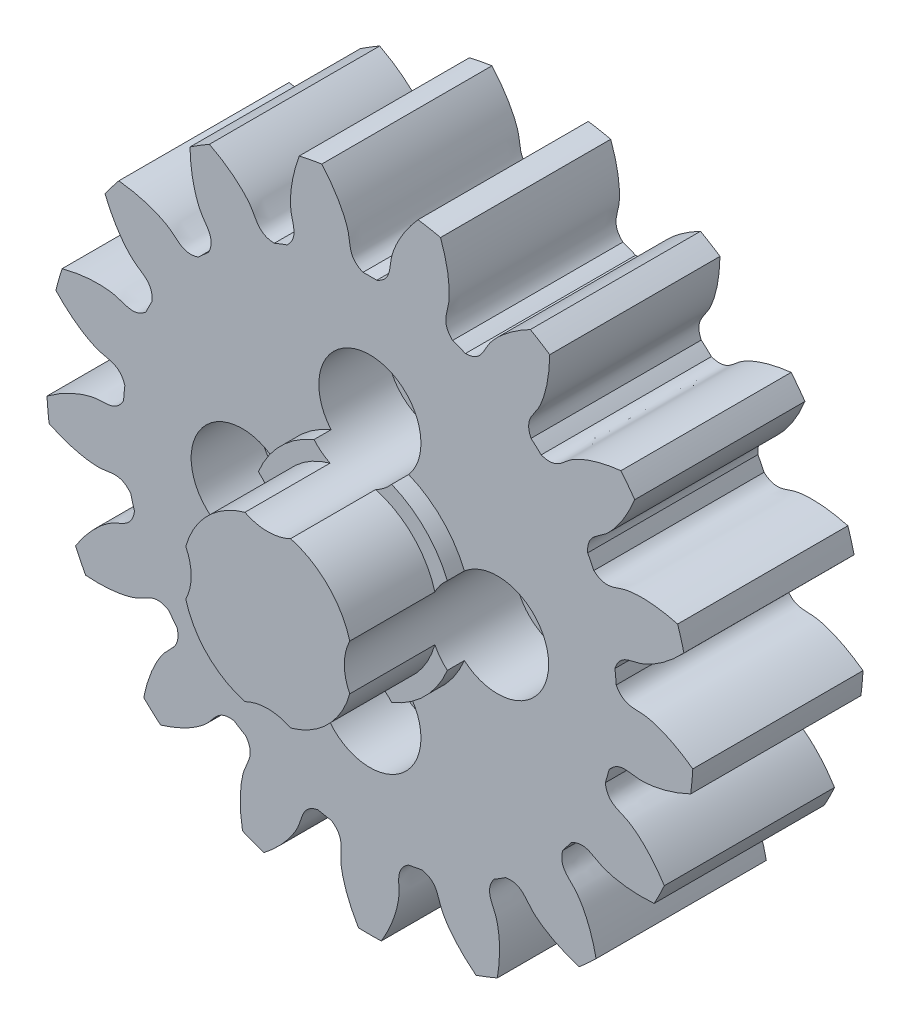
from build123d import *

# Parameters (mm, degrees)
SKETCH_1_R               = 19
EXTRUDE_1_DEPTH          = 10
CUT_EXTRUDE_1_DEPTH      = 29.670542374
PATTERN_CIRCULAR_1_COUNT = 17
SKETCH_4_R               = 6
EXTRUDE_2_DEPTH          = 1
SKETCH_5_R               = 5
EXTRUDE_3_DEPTH          = 5
CUT_EXTRUDE_2_REACH      = 30.65
SKETCH_6_R               = 1.25
SKETCH_7_R               = 2.5
CUT_EXTRUDE_3_DEPTH      = 5
SKETCH_8_R               = 3
CUT_EXTRUDE_4_DEPTH      = 10


with BuildPart() as part:
    # 草图1 → 凸台-拉伸1 (new body)
    with BuildSketch(Plane.XY):
        Circle(SKETCH_1_R)
    extrude(amount=EXTRUDE_1_DEPTH)

    # 草图2 → 切除-拉伸1 (cut, through all)
    with BuildSketch(Plane.XY):
        with BuildLine():
            ThreePointArc((0.403387494, 14.494387829), (0, 14.5), (-0.403387494, 14.494387829))
            add(Edge.make_bspline(
                [(-0.403387494, 14.494387829), (-1.255759481, 14.849644042), (-1.132390756, 15.509626813), (-1.276611209, 16.129648275), (-1.289951469, 16.18230119), (-1.306037005, 16.240838627), (-1.32510118, 16.305170665), (-1.347383555, 16.375198727), (-1.373118159, 16.450817515), (-1.40253689, 16.531914502), (-1.435868224, 16.618370188), (-1.473337358, 16.710058129), (-1.515165928, 16.80684504), (-1.561571855, 16.908590882), (-1.612769151, 17.015148962), (-1.66896775, 17.12636603), (-1.730373323, 17.242082389), (-1.797187111, 17.362132), (-1.869605751, 17.4863426), (-1.947821109, 17.61453582), (-2.032020115, 17.746527309), (-2.1223846, 17.882126855), (-2.219091138, 18.021138524), (-2.32231089, 18.163360791), (-2.432209452, 18.308586678), (-2.548946705, 18.456603899), (-2.67267667, 18.607195006), (-2.803547366, 18.760137539), (-2.941700674, 18.915204179), (-3.087272199, 19.072162909), (-3.24039114, 19.23077717), (-3.401180166, 19.390806026), (-3.569755292, 19.552004336), (-3.746225758, 19.71412292), (-3.930693918, 19.876908731), (-4.123255131, 20.040105038), (-4.323997649, 20.203451599), (-4.533002522, 20.366684847), (-4.750343497, 20.529538073), (-4.976086928, 20.691741613), (-5.210291694, 20.853023038), (-5.453009069, 21.013107349), (-5.79164327, 21.226861067), (-6.053153804, 21.381051942), (-6.231291666, 21.481438237)],
                knots=[0, 0, 0, 0, 0.193882922, 0.199023975, 0.204850501, 0.211362501, 0.218559975, 0.226442923, 0.235011345, 0.24426524, 0.254204608, 0.264829451, 0.276139767, 0.288135557, 0.300816821, 0.314183558, 0.328235769, 0.342973453, 0.358396612, 0.374505244, 0.39129935, 0.408778929, 0.426943982, 0.445794509, 0.46533051, 0.485551984, 0.506458932, 0.528051354, 0.550329249, 0.573292619, 0.596941461, 0.621275778, 0.646295568, 0.672000832, 0.69839157, 0.725467781, 0.753229466, 0.781676625, 0.810809257, 0.840627364, 0.871130943, 0.902319997, 0.934194524, 1, 1, 1, 1], degree=3))
            ThreePointArc((-6.231291666, 21.481438237), (0, 22.366966369), (6.231291666, 21.481438237))
            add(Edge.make_bspline(
                [(0.403387494, 14.494387829), (1.255759481, 14.849644042), (1.132390756, 15.509626813), (1.276611209, 16.129648275), (1.289951469, 16.18230119), (1.306037005, 16.240838627), (1.32510118, 16.305170665), (1.347383555, 16.375198727), (1.373118159, 16.450817515), (1.40253689, 16.531914502), (1.435868224, 16.618370188), (1.473337358, 16.710058129), (1.515165928, 16.80684504), (1.561571855, 16.908590882), (1.612769151, 17.015148962), (1.66896775, 17.12636603), (1.730373323, 17.242082389), (1.797187111, 17.362132), (1.869605751, 17.4863426), (1.947821109, 17.61453582), (2.032020115, 17.746527309), (2.1223846, 17.882126855), (2.219091138, 18.021138524), (2.32231089, 18.163360791), (2.432209452, 18.308586678), (2.548946705, 18.456603899), (2.67267667, 18.607195006), (2.803547366, 18.760137539), (2.941700674, 18.915204179), (3.087272199, 19.072162909), (3.24039114, 19.23077717), (3.401180166, 19.390806026), (3.569755292, 19.552004336), (3.746225758, 19.71412292), (3.930693918, 19.876908731), (4.123255131, 20.040105038), (4.323997649, 20.203451599), (4.533002522, 20.366684847), (4.750343497, 20.529538073), (4.976086928, 20.691741613), (5.210291694, 20.853023038), (5.453009069, 21.013107349), (5.79164327, 21.226861067), (6.053153804, 21.381051942), (6.231291666, 21.481438237)],
                knots=[0, 0, 0, 0, 0.193882922, 0.199023975, 0.204850501, 0.211362501, 0.218559975, 0.226442923, 0.235011345, 0.24426524, 0.254204608, 0.264829451, 0.276139767, 0.288135557, 0.300816821, 0.314183558, 0.328235769, 0.342973453, 0.358396612, 0.374505244, 0.39129935, 0.408778929, 0.426943982, 0.445794509, 0.46533051, 0.485551984, 0.506458932, 0.528051354, 0.550329249, 0.573292619, 0.596941461, 0.621275778, 0.646295568, 0.672000832, 0.69839157, 0.725467781, 0.753229466, 0.781676625, 0.810809257, 0.840627364, 0.871130943, 0.902319997, 0.934194524, 1, 1, 1, 1], degree=3))
        make_face()
    cut_extrude_1 = extrude(amount=CUT_EXTRUDE_1_DEPTH, mode=Mode.SUBTRACT)

    # 阵列(圆周)1: 切除-拉伸1 ×17 about axis
    pattern_circular_1_axis = Axis((0, 0, -0.5), (0, 0, 1))
    for i in range(1, PATTERN_CIRCULAR_1_COUNT):
        add(cut_extrude_1.rotate(pattern_circular_1_axis, i * 360 / PATTERN_CIRCULAR_1_COUNT), mode=Mode.SUBTRACT)

    # 草图4 → 凸台-拉伸2 (add)
    with BuildSketch(Plane.XY.offset(10)):
        Circle(SKETCH_4_R)
    extrude(amount=EXTRUDE_2_DEPTH)

    # 草图5 → 凸台-拉伸3 (add)
    with BuildSketch(Plane.XY.offset(11)):
        Circle(SKETCH_5_R)
    extrude(amount=EXTRUDE_3_DEPTH)

    # 草图6 → 切除-拉伸2 (cut, up to next)
    with BuildSketch(Plane.XY.offset(10), mode=Mode.PRIVATE) as cut_extrude_2_sk1:
        with Locations((0, 7.5)):
            Circle(SKETCH_6_R)
    cut_extrude_2_tool1 = extrude(cut_extrude_2_sk1.sketch, amount=-CUT_EXTRUDE_2_REACH, mode=Mode.PRIVATE) & part.part
    # 草图6 → 切除-拉伸2 (cut, up to next)
    with BuildSketch(Plane.XY.offset(10), mode=Mode.PRIVATE) as cut_extrude_2_sk2:
        with Locations((7.5, 0)):
            Circle(SKETCH_6_R)
    cut_extrude_2_tool2 = extrude(cut_extrude_2_sk2.sketch, amount=-CUT_EXTRUDE_2_REACH, mode=Mode.PRIVATE) & part.part
    # 草图6 → 切除-拉伸2 (cut, up to next)
    with BuildSketch(Plane.XY.offset(10), mode=Mode.PRIVATE) as cut_extrude_2_sk3:
        with Locations((0, -7.5)):
            Circle(SKETCH_6_R)
    cut_extrude_2_tool3 = extrude(cut_extrude_2_sk3.sketch, amount=-CUT_EXTRUDE_2_REACH, mode=Mode.PRIVATE) & part.part
    # 草图6 → 切除-拉伸2 (cut, up to next)
    with BuildSketch(Plane.XY.offset(10), mode=Mode.PRIVATE) as cut_extrude_2_sk4:
        with Locations((-7.5, 0)):
            Circle(SKETCH_6_R)
    cut_extrude_2_tool4 = extrude(cut_extrude_2_sk4.sketch, amount=-CUT_EXTRUDE_2_REACH, mode=Mode.PRIVATE) & part.part
    add(cut_extrude_2_tool1.solids().sort_by_distance((0, 7.5, 10))[0], mode=Mode.SUBTRACT)
    add(cut_extrude_2_tool2.solids().sort_by_distance((7.5, 0, 10))[0], mode=Mode.SUBTRACT)
    add(cut_extrude_2_tool3.solids().sort_by_distance((0, -7.5, 10))[0], mode=Mode.SUBTRACT)
    add(cut_extrude_2_tool4.solids().sort_by_distance((-7.5, 0, 10))[0], mode=Mode.SUBTRACT)

    # 草图7 → 切除-拉伸3 (cut)
    with BuildSketch(Plane(origin=(0, 0, 0), x_dir=(-1, 0, 0), z_dir=(0, 0, -1))):
        Circle(SKETCH_7_R)
    extrude(amount=-CUT_EXTRUDE_3_DEPTH, mode=Mode.SUBTRACT)

    # 草图8 → 切除-拉伸4 (cut)
    with BuildSketch(Plane.XY.offset(16)):
        with Locations((0, 7.5)):
            Circle(SKETCH_8_R)
        with Locations((7.5, 0)):
            Circle(SKETCH_8_R)
        with Locations((0, -7.5)):
            Circle(SKETCH_8_R)
        with Locations((-7.5, 0)):
            Circle(SKETCH_8_R)
    extrude(amount=-CUT_EXTRUDE_4_DEPTH, mode=Mode.SUBTRACT)


solid = part.part
